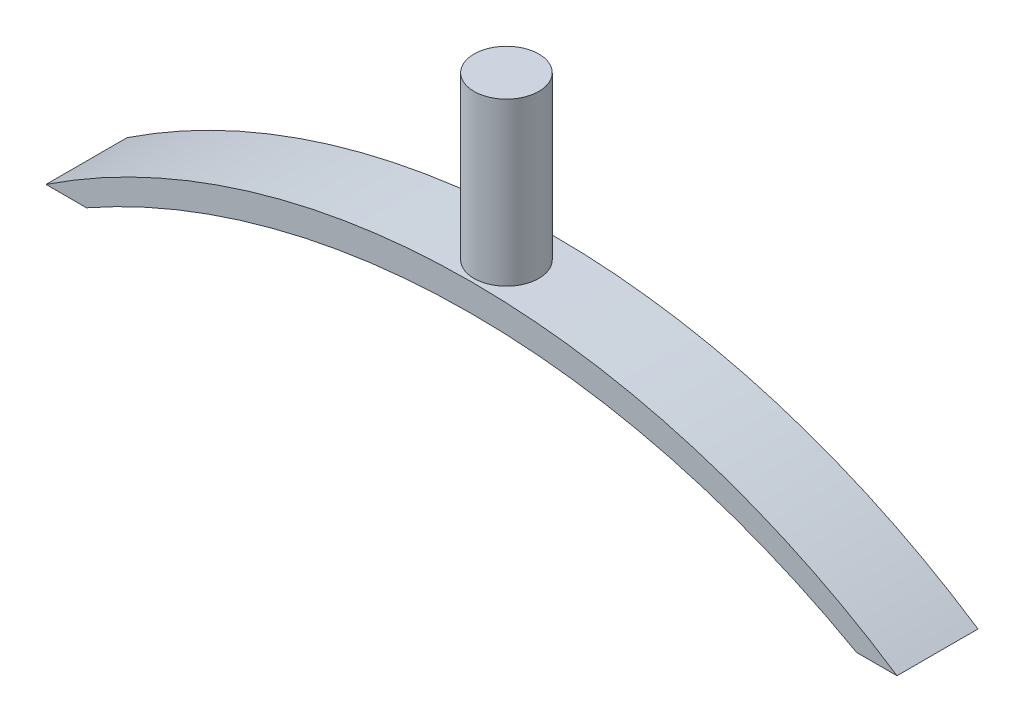
from build123d import *

# Parameters (mm, degrees)
BOSS_EXTRUDE1_DEPTH = 10
SCALE1_SCALE        = 0.5
SKETCH9_R           = 2
BOSS_EXTRUDE3_DEPTH = 10


with BuildPart() as part:
    # Sketch1 → Boss-Extrude1 (new body)
    with BuildSketch(Plane.XY):
        with BuildLine():
            Line((0, 0), (5, 0))
            ThreePointArc((5, 0), (52.528561354, 12.453541306), (100.057122708, 0))
            Line((100.057122708, 0), (105.057122708, 0))
            ThreePointArc((105.057122708, 0), (52.528561354, 15.847728612), (0, 0))
        make_face()
    extrude(amount=BOSS_EXTRUDE1_DEPTH)


with BuildPart() as part_1:
    # Scale1: scaled about (52.528561354, 9.724546383, 5)
    add(part.part.scale(SCALE1_SCALE).moved(Location((26.264280677, 4.862273191, 2.5))))


with BuildPart() as body_2:
    # Sketch9 → Boss-Extrude3 (new body)
    with BuildSketch(Plane(origin=(0, 12.786137497, 0), x_dir=(1, 0, 0), z_dir=(0, 1, 0))):
        with Locations((52.425544039, -5.240143637)):
            Circle(SKETCH9_R)
    extrude(amount=BOSS_EXTRUDE3_DEPTH)


solid = Compound([part_1.part, body_2.part])
